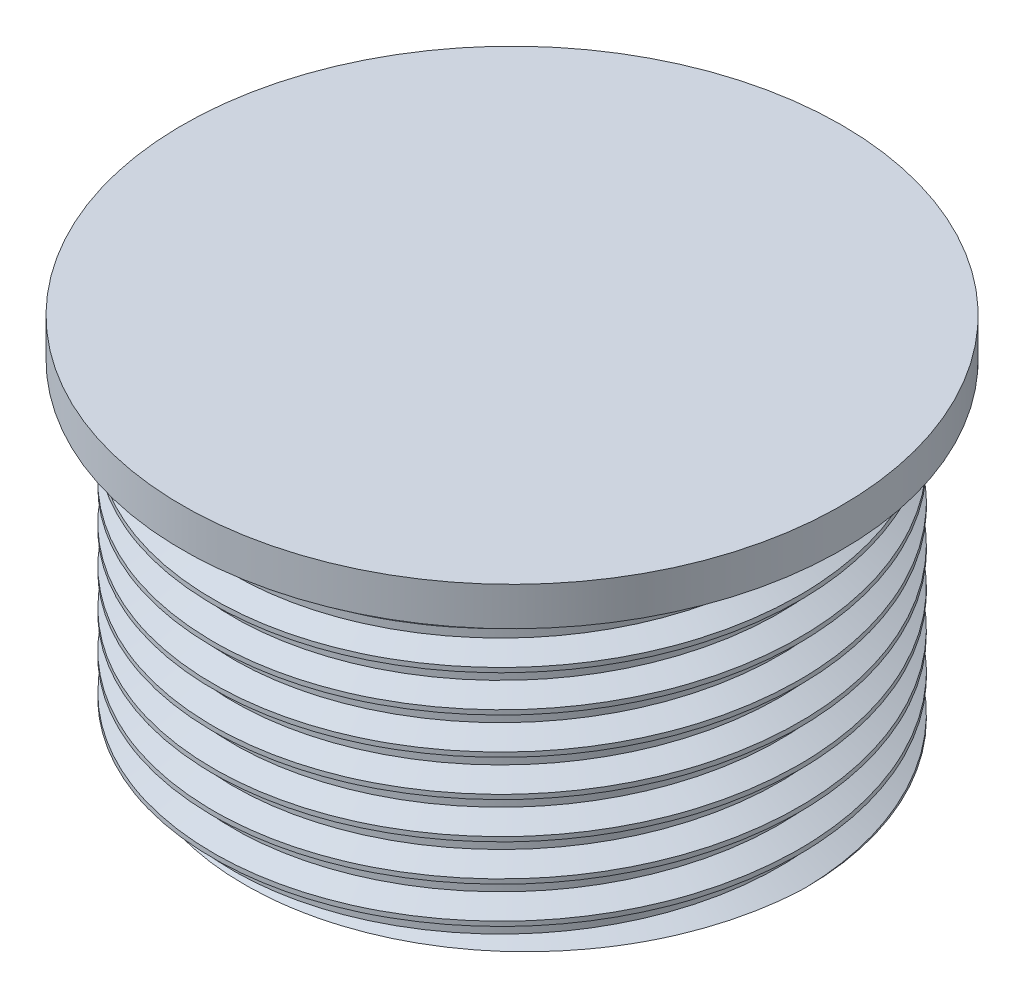
from build123d import *

# Parameters (mm, degrees)
THREAD_2_PITCH = 1


with BuildPart() as part:
    # Эскиз1 → Повернуть1 (revolve)
    with BuildSketch(Plane.XY, mode=Mode.PRIVATE) as revolve_1_sk:
        Polygon((0, 7.046179333), (0, 9.546179333), (-9, 9.546179333), (-9, 8.496099606), (-7.35, 8.496099606), (-7.35, 7.541481673), (-8, 7.541481673), (-8, 0), (-7, 0), (-7, 7.046179333), align=None)
    revolve(revolve_1_sk.sketch.rotate(Axis((0, 7.046179333, 0), (0, 1, 0)), 270), axis=Axis((0, 7.046179333, 0), (0, 1, 0)))

    # Резьба2: the profile of Профиль резьбы2 profile screwed along a right-hand helix of 9.4961 turns, 8 arcs to a turn; built about Z, then put on its axis
    thread_2_z = Axis((0, 0, 0), (0, 0, 1))
    thread_2_corners = [(8.0003, 0, -0.000173205), (8.0003, 0, 0.875173202), (7.458734125, 0, 0.562499999), (7.458734125, 0, 0.312499999)]
    with BuildLine(mode=Mode.PRIVATE) as thread_2_profile:
        Line(thread_2_corners[0], thread_2_corners[1])
        Line(thread_2_corners[1], thread_2_corners[2])
        Line(thread_2_corners[2], thread_2_corners[3])
        Line(thread_2_corners[3], thread_2_corners[0])
    thread_2_cap = Face(thread_2_profile.wire())
    thread_2_turn_angles = [0, 22.5, 45, 67.5, 90, 112.5, 135, 157.5, 180, 202.5, 225, 247.5, 270, 292.5, 315, 337.5, 360]
    thread_2_turn_weights = [1, 0.9238795325112867, 1, 0.9238795325112867, 1, 0.9238795325112867, 1, 0.9238795325112867, 1, 0.9238795325112867, 1, 0.9238795325112867, 1, 0.9238795325112867, 1, 0.9238795325112867, 1]
    thread_2_turn_rails = [Edge.make_bspline([Vector(p[0], p[1], 0).rotate(thread_2_z, thread_2_turn_angles[k]) / thread_2_turn_weights[k] + Vector(0, 0, p[2] + THREAD_2_PITCH * thread_2_turn_angles[k] / 360) for k in range(17)], [0, 0, 0, 1, 1, 2, 2, 3, 3, 4, 4, 5, 5, 6, 6, 7, 7, 8, 8, 8], 2, thread_2_turn_weights) for p in thread_2_corners]
    thread_2_turn_sides = [Face.make_surface_from_curves(thread_2_turn_rails[p[0]], thread_2_turn_rails[p[1]]) for p in [(0, 1), (1, 2), (2, 3), (3, 0)]]
    thread_2_last_angles = [3240, 3262.5, 3285, 3307.5, 3330, 3352.5, 3375, 3396.79792915, 3418.5958583]
    thread_2_last_weights = [1, 0.9238795325112867, 1, 0.9238795325112867, 1, 0.9238795325112867, 1, 0.9284992486777339, 1]
    thread_2_last_rails = [Edge.make_bspline([Vector(p[0], p[1], 0).rotate(thread_2_z, thread_2_last_angles[k]) / thread_2_last_weights[k] + Vector(0, 0, p[2] + THREAD_2_PITCH * thread_2_last_angles[k] / 360) for k in range(9)], [0, 0, 0, 1, 1, 2, 2, 3, 3, 4, 4, 4], 2, thread_2_last_weights) for p in thread_2_corners]
    thread_2_last_sides = [Face.make_surface_from_curves(thread_2_last_rails[p[0]], thread_2_last_rails[p[1]]) for p in [(0, 1), (1, 2), (2, 3), (3, 0)]]
    thread_2 = Plane(origin=(0, -2, 0), x_dir=(1, 0, 0), z_dir=(0, 1, 0)) * Solid(Shell([*[p.moved(Location((0, 0, THREAD_2_PITCH * i))) for i in range(9) for p in thread_2_turn_sides], *thread_2_last_sides, thread_2_cap, thread_2_cap.rotate(thread_2_z, 3418.5958583).moved(Location((0, 0, THREAD_2_PITCH * 3418.5958583 / 360)))]))
    add(thread_2, mode=Mode.SUBTRACT)


solid = part.part
